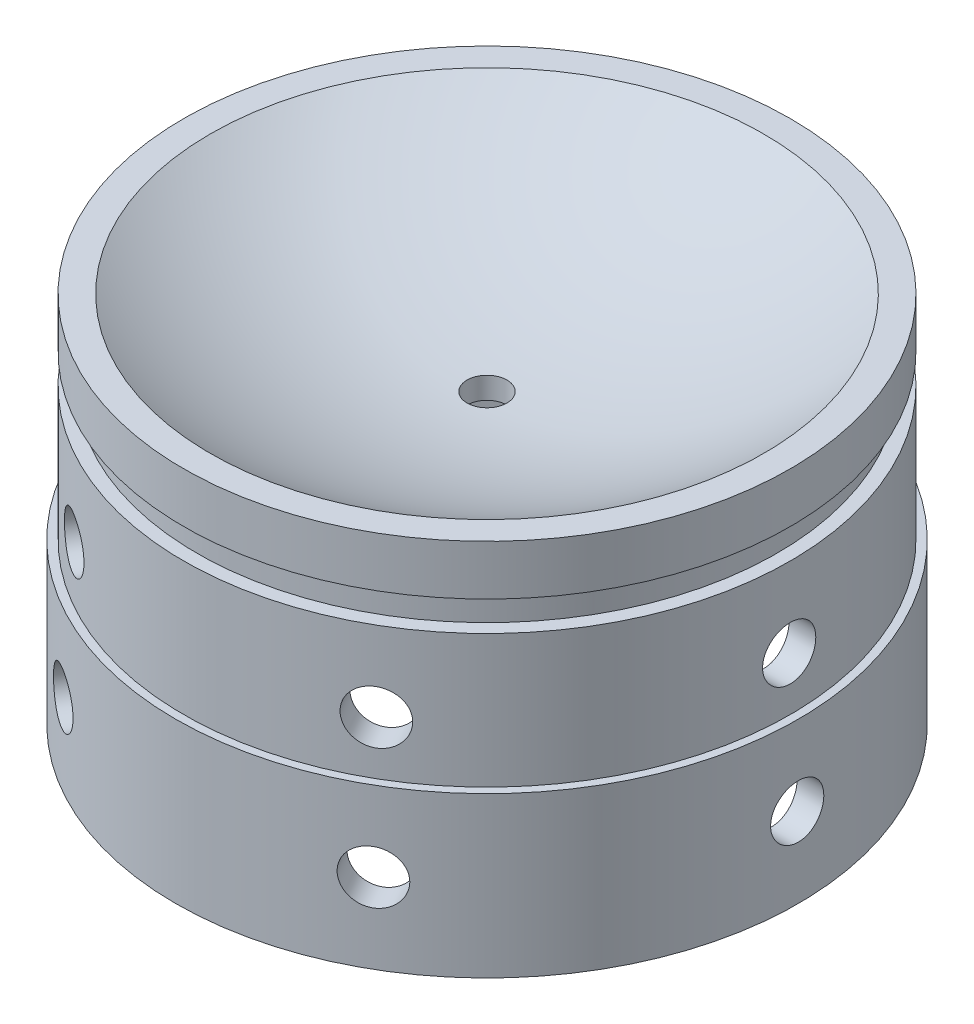
from build123d import *

# Parameters (mm, degrees)
MAIN_LINE_HOLE_REACH      = 124.767
MAIN_LINE_HOLE_END_RADIUS = 117.475
SKETCH10_R                = 4.7625
CHAMFER1_SIZE             = 2.54
SCALE1_SCALE              = 0.5
CIRPATTERN1_COUNT         = 6


with BuildPart() as part:
    # Sketch1 → Revolve1 (revolve)
    with BuildSketch(Plane.XY, mode=Mode.PRIVATE) as revolve1_sk:
        with BuildLine():
            Line((0, 5.08), (0, 0))
            Line((0, 0), (66.04, 0))
            Line((66.04, 0), (72.39, 0))
            Line((72.39, 0), (72.39, 6.35))
            Line((72.39, 6.35), (69.215, 6.35))
            Line((69.215, 6.35), (69.215, 13.462))
            Line((69.215, 13.462), (72.39, 13.462))
            Line((72.39, 13.462), (72.39, 25.4))
            Line((72.39, 25.4), (66.04, 25.4))
            ThreePointArc((66.04, 25.4), (34.547735092, 10.27486095), (0, 5.08))
        make_face()
        Polygon((72.39, 0), (66.04, 0), (66.04, -25.4), (67.945, -25.4), (72.39, -25.4), align=None)
        Polygon((74.295, -25.4), (72.39, -25.4), (67.945, -25.4), (67.945, -63.5), (74.295, -63.5), align=None)
    revolve(revolve1_sk.sketch.rotate(Axis((0, 0, 0), (0, 1, 0)), 90), axis=Axis((0, 0, 0), (0, 1, 0)))

    # Main Line Hole: up to this sphere (the profile starts outside it)
    main_line_hole_end = Location((0, 122.555, 0)) * Sphere(MAIN_LINE_HOLE_END_RADIUS, mode=Mode.PRIVATE)
    # Sketch10 → Main Line Hole (cut, up to the surface)
    with BuildSketch(Plane.XZ, mode=Mode.PRIVATE) as main_line_hole_sk1:
        with Locations(Location((0, 0, 0), (0, 0, 270))):
            Circle(SKETCH10_R)
    main_line_hole_tool1 = extrude(main_line_hole_sk1.sketch, amount=-MAIN_LINE_HOLE_REACH, mode=Mode.PRIVATE) - main_line_hole_end
    add(main_line_hole_tool1.solids().sort_by_distance((0, 0, 0))[0], mode=Mode.SUBTRACT)

    # Chamfer1
    # the kernel refuses this chamfer: 2.54 mm, written as the material it adds along each edge
    with BuildSketch(Plane(origin=(0, -25.4, 0), x_dir=(0, 0, -1), z_dir=(1, 0, 0))) as chamfer1_piece_1_section:
        Polygon((67.945 - CHAMFER1_SIZE, 0), (67.945, -CHAMFER1_SIZE), (67.945, 0), align=None)
    chamfer1_piece_1 = revolve(axis=Axis((0, -25.4, 0), (0, 1, 0)), mode=Mode.PRIVATE)
    chamfer1_piece_1 = chamfer1_piece_1 - Plane(origin=(0, -26.944579126, 0), x_dir=(0, 0, -1), z_dir=(0, -1, 0)) * Cylinder(66.04, 272, mode=Mode.PRIVATE)
    add(chamfer1_piece_1)


with BuildPart() as part_1:
    # Scale1: scaled about (0, -7.16654755, 0)
    add(part.part.scale(SCALE1_SCALE).moved(Location((0, -3.583273775, 0))))

    # Sketch9 → 1/4 (0.25) Diameter Hole1 (revolve, cut)
    with BuildSketch(Plane(origin=(37.1475, -25.808273775, 0), x_dir=(0, 0, -1), z_dir=(0, 1, 0))):
        Polygon((0, 0), (0, 39.054232465), (3.175, 37.1465), (3.175, 0), align=None)
    f_1_4_0_25_diameter_hole1 = revolve(axis=Axis((43.4975, -25.808273775, 0), (-1, 0, 0)), mode=Mode.SUBTRACT)

    # Sketch8 → 1/4 (0.25) Diameter Hole2 (revolve, cut)
    with BuildSketch(Plane(origin=(36.195, -9.933273775, 0), x_dir=(0, 0, -1), z_dir=(0, 1, 0))):
        Polygon((0, 0), (0, 38.101732465), (3.175, 36.194), (3.175, 0), align=None)
    f_1_4_0_25_diameter_hole2 = revolve(axis=Axis((42.545, -9.933273775, 0), (-1, 0, 0)), mode=Mode.SUBTRACT)

    # CirPattern1: 1/4 (0.25) Diameter Hole1, 1/4 (0.25) Diameter Hole2 ×6 about axis
    cirpattern1_axis = Axis((0, -16.283273775, 0), (0, -1, 0))
    add([f_1_4_0_25_diameter_hole1.rotate(cirpattern1_axis, i * 360 / CIRPATTERN1_COUNT) for i in range(1, CIRPATTERN1_COUNT)], mode=Mode.SUBTRACT)
    add([f_1_4_0_25_diameter_hole2.rotate(cirpattern1_axis, i * 360 / CIRPATTERN1_COUNT) for i in range(1, CIRPATTERN1_COUNT)], mode=Mode.SUBTRACT)


solid = part_1.part
